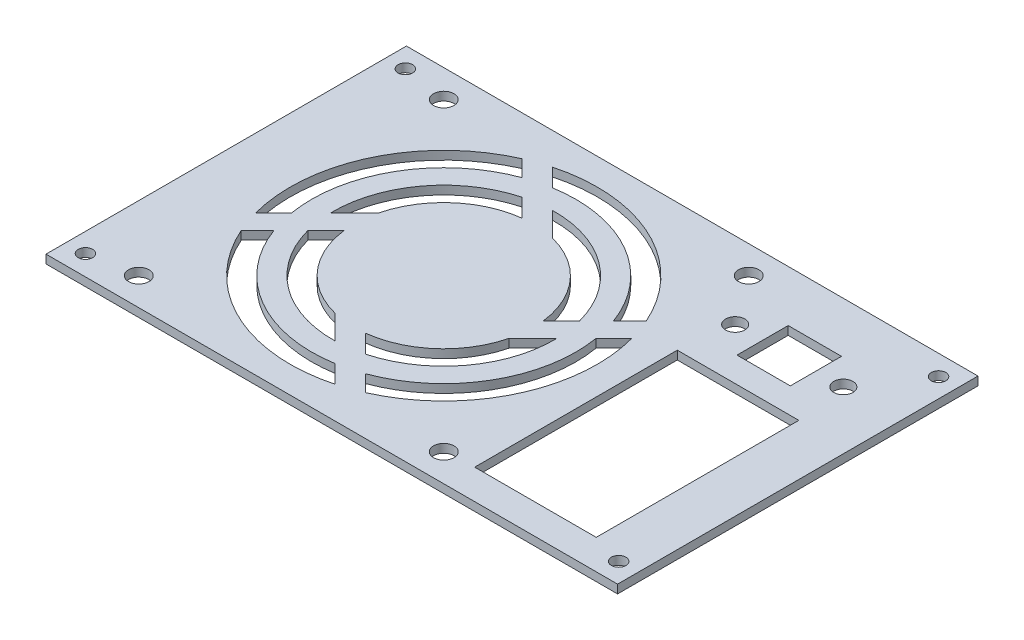
from build123d import *

# Parameters (mm, degrees)
SKETCH1_W                = 134
SKETCH1_H                = 84.5
BOSS_EXTRUDE1_DEPTH      = 2
M3_CLEARANCE_HOLE1_D     = 3.4
M3_CLEARANCE_HOLE1_DEPTH = 5
M3_CLEARANCE_HOLE1_TIP   = 1.021463052
M4_CLEARANCE_HOLE1_D     = 4.8
SKETCH9_W                = 28.5
SKETCH9_H                = 47.5
SKETCH9_W_2              = 12.5
SKETCH9_H_2              = 12
CUT_EXTRUDE1_DEPTH       = 159.430584169
M4_CLEARANCE_HOLE2_D     = 4.5
CUT_EXTRUDE5_DEPTH       = 159.430584169


with BuildPart() as part:
    # Sketch1 → Boss-Extrude1 (new body)
    with BuildSketch(Plane(origin=(0, 0, 0), x_dir=(1, 0, 0), z_dir=(0, 1, 0))):
        with Locations((67, 42.25)):
            Rectangle(SKETCH1_W, SKETCH1_H)
    extrude(amount=BOSS_EXTRUDE1_DEPTH)

    # M3 Clearance Hole1
    with Locations(Plane(origin=(0, 2, 0), x_dir=(1, 0, 0), z_dir=(0, 1, 0))):
        with Locations((4.5, 79.75), (129.5, 79.75), (129.5, 4.75), (4.5, 4.75)):
            Hole(M3_CLEARANCE_HOLE1_D / 2, depth=M3_CLEARANCE_HOLE1_DEPTH)
            with Locations((0, 0, -(M3_CLEARANCE_HOLE1_DEPTH + M3_CLEARANCE_HOLE1_TIP / 2))):  # 118° drill point
                Cone(0, M3_CLEARANCE_HOLE1_D / 2, M3_CLEARANCE_HOLE1_TIP, mode=Mode.SUBTRACT)

    # M4 Clearance Hole1 (through all)
    with Locations(Plane(origin=(0, 2, 0), x_dir=(1, 0, 0), z_dir=(0, 1, 0))):
        with Locations((15.25, 78), (86.75, 78), (86.75, 6.5), (15.25, 6.5)):
            Hole(M4_CLEARANCE_HOLE1_D / 2)

    # Sketch9 → Cut-Extrude1 (cut, through all)
    with BuildSketch(Plane(origin=(0, 2, 0), x_dir=(1, 0, 0), z_dir=(0, 1, 0))):
        with Locations((107.75, 30.75)):
            Rectangle(SKETCH9_W, SKETCH9_H)
        with Locations((107.75, 66.5)):
            Rectangle(SKETCH9_W_2, SKETCH9_H_2)
    extrude(amount=-CUT_EXTRUDE1_DEPTH, mode=Mode.SUBTRACT)

    # M4 Clearance Hole2 (through all)
    with Locations(Plane(origin=(0, 2, 0), x_dir=(1, 0, 0), z_dir=(0, 1, 0))):
        with Locations((95.075, 66.5), (120.425, 66.5)):
            Hole(M4_CLEARANCE_HOLE2_D / 2)

    # Sketch14 → Cut-Extrude5 (cut, through all)
    with BuildSketch(Plane(origin=(0, 2, 0), x_dir=(1, 0, 0), z_dir=(0, 1, 0))):
        with BuildLine():
            Line((71.854291945, 44.719515634), (76.114071484, 48.979295173))
            ThreePointArc((76.114071484, 48.979295173), (66.613295664, 63.040021609), (50.4614229, 68.244421223))
            Line((50.4614229, 68.244421223), (56.079392791, 62.626451332))
            ThreePointArc((56.079392791, 62.626451332), (66.757651713, 56.131513336), (71.854291945, 44.719515634))
        make_face()
        with BuildLine():
            Line((41.682514376, 77.023329746), (45.881353764, 72.824490359))
            ThreePointArc((45.881353764, 72.824490359), (66.567844262, 69.057503148), (80.092136898, 52.957360587))
            Line((80.092136898, 52.957360587), (83.930543096, 56.795766786))
            ThreePointArc((83.930543096, 56.795766786), (66.546147325, 74.720252592), (41.682514376, 77.023329746))
        make_face()
        with BuildLine():
            Line((53.469515634, 21.395708055), (57.729295173, 17.135928516))
            ThreePointArc((57.729295173, 17.135928516), (71.790021609, 26.636704336), (76.994421223, 42.7885771))
            Line((76.994421223, 42.7885771), (71.376451332, 37.170607209))
            ThreePointArc((71.376451332, 37.170607209), (64.881513336, 26.492348287), (53.469515634, 21.395708055))
        make_face()
        with BuildLine():
            Line((85.773329746, 51.567485624), (81.574490359, 47.368646236))
            ThreePointArc((81.574490359, 47.368646236), (77.807503148, 26.682155738), (61.707360587, 13.157863102))
            Line((61.707360587, 13.157863102), (65.545766786, 9.319456904))
            ThreePointArc((65.545766786, 9.319456904), (83.470252592, 26.703852675), (85.773329746, 51.567485624))
        make_face()
        with BuildLine():
            Line((30.145708055, 39.780484366), (25.885928516, 35.520704827))
            ThreePointArc((25.885928516, 35.520704827), (35.386704336, 21.459978391), (51.5385771, 16.255578777))
            Line((51.5385771, 16.255578777), (45.920607209, 21.873548668))
            ThreePointArc((45.920607209, 21.873548668), (35.242348287, 28.368486664), (30.145708055, 39.780484366))
        make_face()
        with BuildLine():
            Line((60.317485624, 7.476670254), (56.118646236, 11.675509641))
            ThreePointArc((56.118646236, 11.675509641), (35.432155738, 15.442496852), (21.907863102, 31.542639413))
            Line((21.907863102, 31.542639413), (18.069456904, 27.704233214))
            ThreePointArc((18.069456904, 27.704233214), (35.453852675, 9.779747408), (60.317485624, 7.476670254))
        make_face()
        with BuildLine():
            Line((48.530484366, 63.104291945), (44.270704827, 67.364071484))
            ThreePointArc((44.270704827, 67.364071484), (30.209978391, 57.863295664), (25.005578777, 41.7114229))
            Line((25.005578777, 41.7114229), (30.623548668, 47.329392791))
            ThreePointArc((30.623548668, 47.329392791), (37.118486664, 58.007651713), (48.530484366, 63.104291945))
        make_face()
        with BuildLine():
            Line((16.226670254, 32.932514376), (20.425509641, 37.131353764))
            ThreePointArc((20.425509641, 37.131353764), (24.192496852, 57.817844262), (40.292639413, 71.342136898))
            Line((40.292639413, 71.342136898), (36.454233214, 75.180543096))
            ThreePointArc((36.454233214, 75.180543096), (18.529747408, 57.796147325), (16.226670254, 32.932514376))
        make_face()
    extrude(amount=-CUT_EXTRUDE5_DEPTH, mode=Mode.SUBTRACT)


solid = part.part
